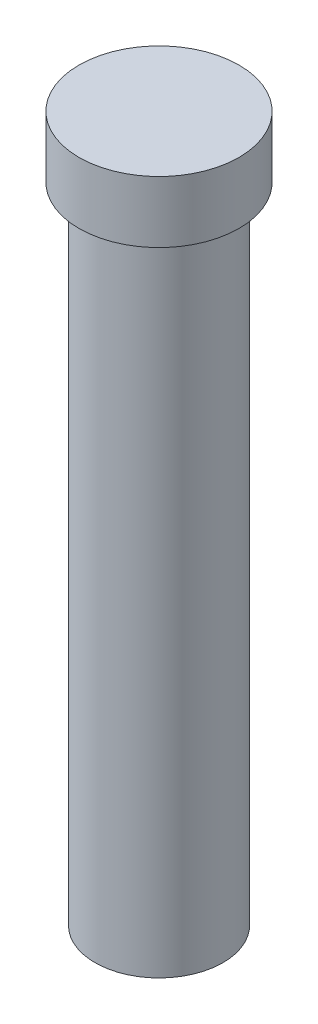
from build123d import *


with BuildPart() as part:
    # Sketch1 → Revolve1 (revolve)
    with BuildSketch(Plane.XY):
        Polygon((0, 0), (6.5, 0), (6.5, -5), (5.2, -5), (5.2, -57.3), (0, -57.3), align=None)
    revolve(axis=Axis((0, -62.3, 0), (0, 1, 0)))


solid = part.part
